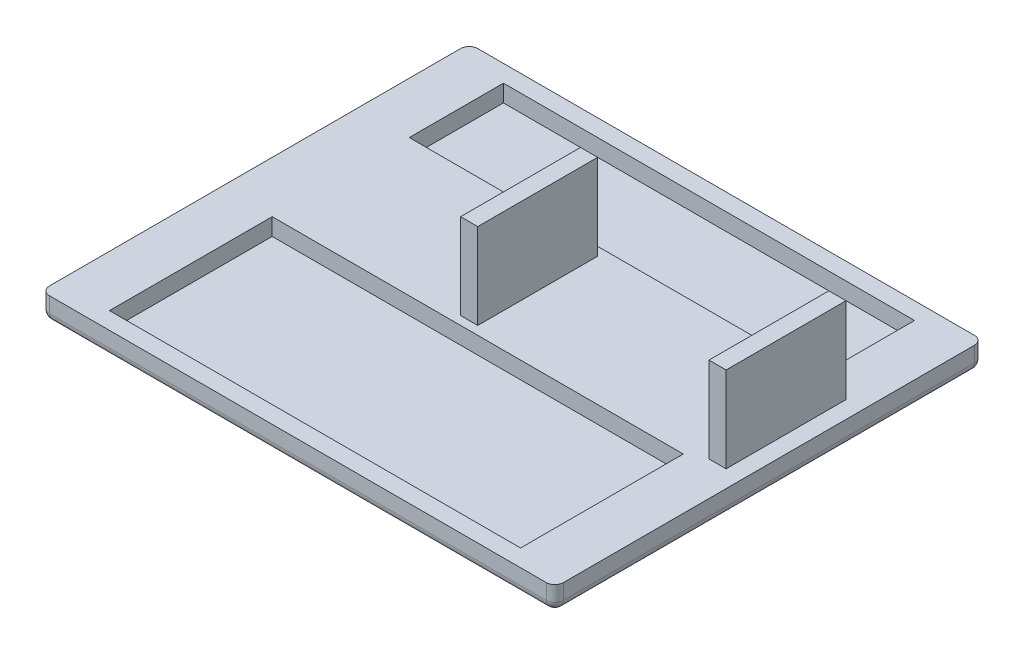
from build123d import *

# Parameters (mm, degrees)
SKETCH1_W          = 300
SKETCH1_H          = 250
BASE_DEPTH         = 14
SKETCH3_W          = 240
SKETCH3_H          = 230
CUT_EXTRUDE1_DEPTH = 10
FILLET1_R          = 5
FILLET2_R          = 5
SKETCH4_W          = 240
SKETCH4_H          = 80
DIN_BASE_DEPTH     = 10
SKETCH5_W          = 10
SKETCH5_H          = 70
DIN_STAND_DEPTH    = 50


with BuildPart() as part:
    # Sketch1 → Base (new body)
    with BuildSketch(Plane(origin=(0, 0, 0), x_dir=(1, 0, 0), z_dir=(0, 1, 0))):
        Rectangle(SKETCH1_W, SKETCH1_H)
    extrude(amount=BASE_DEPTH)

    # Sketch3 → Cut-Extrude1 (cut)
    with BuildSketch(Plane(origin=(0, 14, 0), x_dir=(1, 0, 0), z_dir=(0, 1, 0))):
        Rectangle(SKETCH3_W, SKETCH3_H)
    extrude(amount=-CUT_EXTRUDE1_DEPTH, mode=Mode.SUBTRACT)

    # Fillet1
    fillet1_edges = [part.edges().sort_by_distance(p)[0] for p in [
        (0, 0, 125),
        (-150, 0, 0),
        (0, 0, -125),
        (150, 0, 0),
    ]]
    fillet(fillet1_edges, radius=FILLET1_R)

    # Fillet2
    # the kernel refuses this fillet: 5 mm, written as the material it takes off along each edge
    with BuildSketch(Plane(origin=(145, 5, 120), x_dir=(1, 0, 0), z_dir=(0, 0, 1))) as fillet2_piece_1_section:
        Polygon((0, 0), (FILLET2_R, 0), (FILLET2_R, -FILLET2_R), (0, -FILLET2_R), align=None)
    fillet2_piece_1 = extrude(amount=FILLET2_R, mode=Mode.PRIVATE)
    fillet2_piece_1 = fillet2_piece_1 - Plane(origin=(145, 5, 120), x_dir=(-0.7071067811865475, 0.7071067811865475, 0), z_dir=(0, 0, 1)) * Sphere(FILLET2_R, mode=Mode.PRIVATE)
    add(fillet2_piece_1, mode=Mode.SUBTRACT)
    with BuildSketch(Plane(origin=(-145, 5, 120), x_dir=(-1, 0, 0), z_dir=(0, 0, 1))) as fillet2_piece_2_section:
        Polygon((0, 0), (FILLET2_R, 0), (FILLET2_R, FILLET2_R), (0, FILLET2_R), align=None)
    fillet2_piece_2 = extrude(amount=FILLET2_R, mode=Mode.PRIVATE)
    fillet2_piece_2 = fillet2_piece_2 - Plane(origin=(-145, 5, 120), x_dir=(0.7071067811865475, 0.7071067811865475, 0), z_dir=(0, 0, 1)) * Sphere(FILLET2_R, mode=Mode.PRIVATE)
    add(fillet2_piece_2, mode=Mode.SUBTRACT)
    with BuildSketch(Plane(origin=(145, 5, -120), x_dir=(0, 0, -1), z_dir=(1, 0, 0))) as fillet2_piece_3_section:
        Polygon((0, 0), (FILLET2_R, 0), (FILLET2_R, -FILLET2_R), (0, -FILLET2_R), align=None)
    fillet2_piece_3 = extrude(amount=FILLET2_R, mode=Mode.PRIVATE)
    fillet2_piece_3 = fillet2_piece_3 - Plane(origin=(145, 5, -120), x_dir=(0, 0.7071067811865475, 0.7071067811865475), z_dir=(1, 0, 0)) * Sphere(FILLET2_R, mode=Mode.PRIVATE)
    add(fillet2_piece_3, mode=Mode.SUBTRACT)
    with BuildSketch(Plane(origin=(-145, 5, -120), x_dir=(0, 0, -1), z_dir=(-1, 0, 0))) as fillet2_piece_4_section:
        Polygon((0, 0), (FILLET2_R, 0), (FILLET2_R, FILLET2_R), (0, FILLET2_R), align=None)
    fillet2_piece_4 = extrude(amount=FILLET2_R, mode=Mode.PRIVATE)
    fillet2_piece_4 = fillet2_piece_4 - Plane(origin=(-145, 5, -120), x_dir=(0, 0.7071067811865475, 0.7071067811865475), z_dir=(-1, 0, 0)) * Sphere(FILLET2_R, mode=Mode.PRIVATE)
    add(fillet2_piece_4, mode=Mode.SUBTRACT)
    with BuildSketch(Plane(origin=(150, 5, 125), x_dir=(-1, 0, 0), z_dir=(0, 1, 0)), Plane(origin=(150, 5, -125), x_dir=(0, 0, 1), z_dir=(0, 1, 0))) as fillet2_piece_5:
        with BuildLine():
            CenterArc((FILLET2_R, -FILLET2_R), FILLET2_R, 90, 90)
            Line((0, -FILLET2_R), (0, 0))
            Line((0, 0), (FILLET2_R, 0))
        make_face()
    extrude(amount=21.5, mode=Mode.SUBTRACT)
    with BuildSketch(Plane(origin=(-150, 5, 125), x_dir=(1, 0, 0), z_dir=(0, 1, 0)), Plane(origin=(-150, 5, -125), x_dir=(0, 0, 1), z_dir=(0, 1, 0))) as fillet2_piece_6:
        with BuildLine():
            CenterArc((FILLET2_R, FILLET2_R), FILLET2_R, 180, 90)
            Line((0, FILLET2_R), (0, 0))
            Line((0, 0), (FILLET2_R, 0))
        make_face()
    extrude(amount=21.5, mode=Mode.SUBTRACT)

    # Sketch4 → DIN Base (add)
    with BuildSketch(Plane(origin=(0, 4, 0), x_dir=(1, 0, 0), z_dir=(0, 1, 0))):
        with Locations((0, 20)):
            Rectangle(SKETCH4_W, SKETCH4_H)
    extrude(amount=DIN_BASE_DEPTH)

    # Sketch5 → DIN Stand (add)
    with BuildSketch(Plane(origin=(0, 14, 0), x_dir=(1, 0, 0), z_dir=(0, 1, 0))):
        with Locations((135, 20)):
            Rectangle(SKETCH5_W, SKETCH5_H)
        with Locations((-10, 20)):
            Rectangle(SKETCH5_W, SKETCH5_H)
    extrude(amount=DIN_STAND_DEPTH)


solid = part.part
